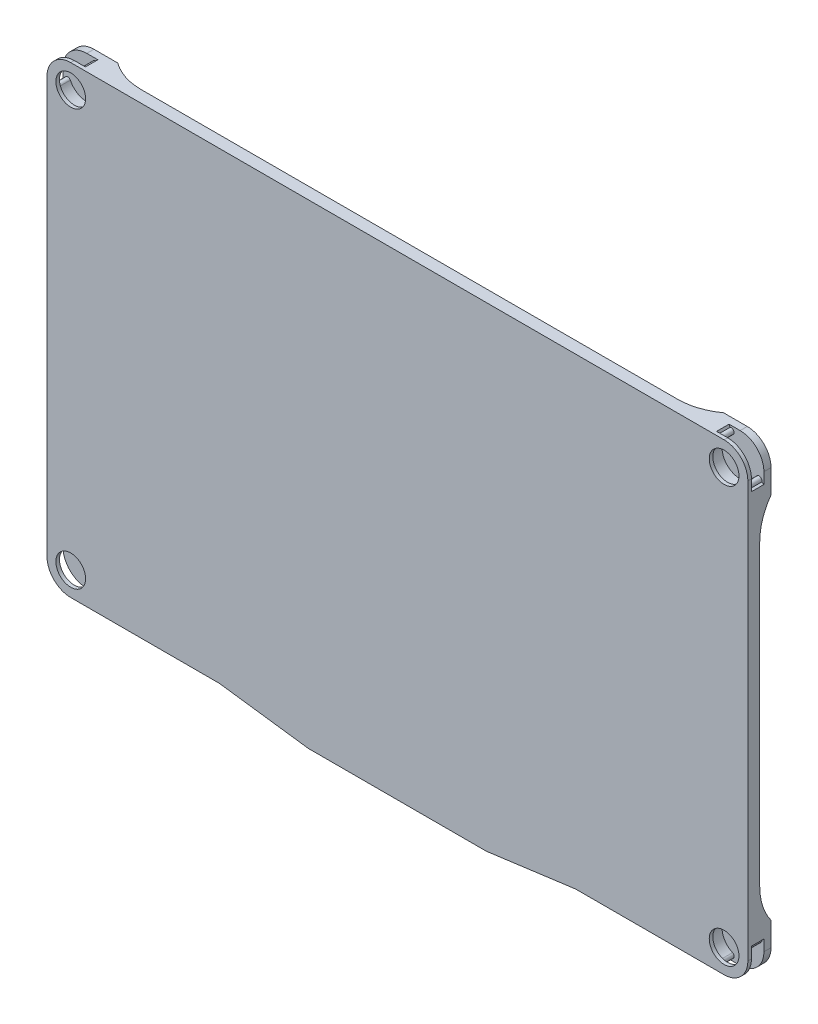
from build123d import *

# Parameters (mm, degrees)
EXTRUDE_1_DEPTH     = 3.9
SKETCH_2_R          = 2.5
CUT_EXTRUDE_1_DEPTH = 0.6
CUT_EXTRUDE_2_DEPTH = 2.1
CUT_EXTRUDE_4_DEPTH = 1.9
FILLET_2_R          = 10


with BuildPart() as part:
    # 草图1 → 凸台-拉伸1 (new body)
    with BuildSketch(Plane.XY):
        with BuildLine():
            Line((-55, -39), (-30, -39))
            Line((-30, -39), (-15, -41))
            Line((-15, -41), (15, -41))
            Line((15, -41), (30, -39))
            Line((30, -39), (55, -39))
            ThreePointArc((55, -39), (57.828427125, -37.828427125), (59, -35))
            Line((59, -35), (59, 35))
            ThreePointArc((59, 35), (57.828427125, 37.828427125), (55, 39))
            Line((55, 39), (-55, 39))
            ThreePointArc((-55, 39), (-57.828427125, 37.828427125), (-59, 35))
            Line((-59, 35), (-59, -35))
            ThreePointArc((-59, -35), (-57.828427125, -37.828427125), (-55, -39))
        make_face()
    extrude(amount=EXTRUDE_1_DEPTH)

    # 草图2 → 切除-拉伸1 (cut)
    with BuildSketch(Plane.XY.offset(3.9)):
        with Locations((55, 35)):
            Circle(SKETCH_2_R)
        with Locations(Location((-55, 35, 0), (0, 0, 180))):
            Circle(SKETCH_2_R)
        with Locations(Location((55, -35, 0), (0, 0, 180))):
            Circle(SKETCH_2_R)
        with Locations((-55, -35)):
            Circle(SKETCH_2_R)
    extrude(amount=-CUT_EXTRUDE_1_DEPTH, mode=Mode.SUBTRACT)

    # 草图3 → 切除-拉伸2 (cut)
    with BuildSketch(Plane.XY.offset(3.3)):
        with BuildLine():
            Line((53.309526953, 38.625231148), (52.886908691, 39.531538935))
            ThreePointArc((52.886908691, 39.531538935), (58.535533906, 38.535533906), (59.531538935, 32.886908691))
            Line((59.531538935, 32.886908691), (58.625231148, 33.309526953))
            ThreePointArc((58.625231148, 33.309526953), (58.395478624, 33.940766826), (57.76423875, 33.711014302))
            ThreePointArc((57.76423875, 33.711014302), (52.843324317, 32.843324317), (53.711014302, 37.76423875))
            ThreePointArc((53.711014302, 37.76423875), (53.940766826, 38.395478624), (53.309526953, 38.625231148))
        make_face()
        with BuildLine():
            Line((-58.625231148, 33.309526953), (-59.531538935, 32.886908691))
            ThreePointArc((-59.531538935, 32.886908691), (-58.535533906, 38.535533906), (-52.886908691, 39.531538935))
            Line((-52.886908691, 39.531538935), (-53.309526953, 38.625231148))
            ThreePointArc((-53.309526953, 38.625231148), (-53.940766826, 38.395478624), (-53.711014302, 37.76423875))
            ThreePointArc((-53.711014302, 37.76423875), (-52.843324317, 32.843324317), (-57.76423875, 33.711014302))
            ThreePointArc((-57.76423875, 33.711014302), (-58.395478624, 33.940766826), (-58.625231148, 33.309526953))
        make_face()
        with BuildLine():
            Line((-53.309526953, -38.625231148), (-52.886908691, -39.531538935))
            ThreePointArc((-52.886908691, -39.531538935), (-58.535533906, -38.535533906), (-59.531538935, -32.886908691))
            Line((-59.531538935, -32.886908691), (-58.625231148, -33.309526953))
            ThreePointArc((-58.625231148, -33.309526953), (-58.395478624, -33.940766826), (-57.76423875, -33.711014302))
            ThreePointArc((-57.76423875, -33.711014302), (-52.843324317, -32.843324317), (-53.711014302, -37.76423875))
            ThreePointArc((-53.711014302, -37.76423875), (-53.940766826, -38.395478624), (-53.309526953, -38.625231148))
        make_face()
        with BuildLine():
            Line((58.625231148, -33.309526953), (59.531538935, -32.886908691))
            ThreePointArc((59.531538935, -32.886908691), (58.535533906, -38.535533906), (52.886908691, -39.531538935))
            Line((52.886908691, -39.531538935), (53.309526953, -38.625231148))
            ThreePointArc((53.309526953, -38.625231148), (53.940766826, -38.395478624), (53.711014302, -37.76423875))
            ThreePointArc((53.711014302, -37.76423875), (52.843324317, -32.843324317), (57.76423875, -33.711014302))
            ThreePointArc((57.76423875, -33.711014302), (58.395478624, -33.940766826), (58.625231148, -33.309526953))
        make_face()
    extrude(amount=-CUT_EXTRUDE_2_DEPTH, mode=Mode.SUBTRACT)

    # 草图5 → 切除-拉伸4 (cut)
    with BuildSketch(Plane(origin=(0, 0, 0), x_dir=(-1, 0, 0), z_dir=(0, 0, -1))):
        with BuildLine():
            Line((-51, 35), (-51, 39))
            Line((-51, 39), (51, 39))
            Line((51, 39), (51, 35))
            ThreePointArc((51, 35), (52.171572875, 32.171572875), (55, 31))
            Line((55, 31), (59, 31))
            Line((59, 31), (59, -31))
            Line((59, -31), (55, -31))
            ThreePointArc((55, -31), (52.171572875, -32.171572875), (51, -35))
            Line((51, -35), (51, -39))
            Line((51, -39), (30, -39))
            Line((30, -39), (15, -41))
            Line((15, -41), (-15, -41))
            Line((-15, -41), (-30, -39))
            Line((-30, -39), (-51, -39))
            Line((-51, -39), (-51, -35))
            ThreePointArc((-51, -35), (-52.171572875, -32.171572875), (-55, -31))
            Line((-55, -31), (-59, -31))
            Line((-59, -31), (-59, 31))
            Line((-59, 31), (-55, 31))
            ThreePointArc((-55, 31), (-52.171572875, 32.171572875), (-51, 35))
        make_face()
    extrude(amount=-CUT_EXTRUDE_4_DEPTH, mode=Mode.SUBTRACT)

    # 圆角2
    # the kernel refuses this fillet: 10 mm, written as the material it adds along each edge
    with BuildSketch(Plane(origin=(-59, -31, 1.9), x_dir=(0, 1, 0), z_dir=(1, 0, 0)), Plane(origin=(-51, 39, 1.9), x_dir=(1, 0, 0), z_dir=(0, -1, 0)), Plane(origin=(55, -31, 1.9), x_dir=(0, 1, 0), z_dir=(1, 0, 0)), Plane(origin=(51, 35, 1.9), x_dir=(-1, 0, 0), z_dir=(0, 1, 0)), Plane(origin=(59, 31, 1.9), x_dir=(0, -1, 0), z_dir=(-1, 0, 0)), Plane(origin=(-55, 31, 1.9), x_dir=(0, -1, 0), z_dir=(-1, 0, 0)), Plane(origin=(51, -39, 1.9), x_dir=(-1, 0, 0), z_dir=(0, 1, 0))) as fillet_2_piece_1:
        with BuildLine():
            CenterArc((5.864298765, -10), FILLET_2_R, 90, 35.904068583)
            Line((0, -1.9), (-0.117285975, -1.738))
            ThreePointArc((-0.117285975, -1.738), (-0.2, -0.95), (-0.2, 0))
            Line((-0.2, 0), (0, 0.2))
            Line((0, 0.2), (5.864298765, 0.2))
            Line((5.864298765, 0.2), (5.864298765, 0))
        make_face()
    extrude(amount=4)
    with BuildSketch(Plane(origin=(-55, -35, 1.9), x_dir=(0, 1, 0), z_dir=(-1, 0, 0))) as fillet_2_piece_2:
        with BuildLine():
            CenterArc((9.864298765, 10), FILLET_2_R, 234.095931417, 35.904068583)
            Line((4, 1.9), (3.882714025, 1.738))
            ThreePointArc((3.882714025, 1.738), (3.8, 0.95), (3.8, 0))
            Line((3.8, 0), (4, -0.2))
            Line((4, -0.2), (9.864298765, -0.2))
            Line((9.864298765, -0.2), (9.864298765, 0))
        make_face()
    revolve(axis=Axis((-55, -35, 1.9), (0, 0, -1)), revolution_arc=90)
    with BuildSketch(Plane(origin=(-55, 35, 1.9), x_dir=(1, 0, 0), z_dir=(0, 1, 0))) as fillet_2_piece_3:
        with BuildLine():
            CenterArc((9.864298765, 10), FILLET_2_R, 234.095931417, 35.904068583)
            Line((4, 1.9), (3.882714025, 1.738))
            ThreePointArc((3.882714025, 1.738), (3.8, 0.95), (3.8, 0))
            Line((3.8, 0), (4, -0.2))
            Line((4, -0.2), (9.864298765, -0.2))
            Line((9.864298765, -0.2), (9.864298765, 0))
        make_face()
    revolve(axis=Axis((-55, 35, 1.9), (0, 0, -1)), revolution_arc=90)
    with BuildSketch(Plane(origin=(55, -35, 1.9), x_dir=(-1, 0, 0), z_dir=(0, -1, 0))) as fillet_2_piece_4:
        with BuildLine():
            CenterArc((9.864298765, 10), FILLET_2_R, 234.095931417, 35.904068583)
            Line((4, 1.9), (3.882714025, 1.738))
            ThreePointArc((3.882714025, 1.738), (3.8, 0.95), (3.8, 0))
            Line((3.8, 0), (4, -0.2))
            Line((4, -0.2), (9.864298765, -0.2))
            Line((9.864298765, -0.2), (9.864298765, 0))
        make_face()
    revolve(axis=Axis((55, -35, 1.9), (0, 0, -1)), revolution_arc=90)
    with BuildSketch(Plane(origin=(-51, -35, 1.9), x_dir=(0, 0, -1), z_dir=(0, -1, 0))) as fillet_2_piece_5:
        with BuildLine():
            CenterArc((10, 5.864298765), FILLET_2_R, 180, 35.904068583)
            Line((0, 5.864298765), (-0.2, 5.864298765))
            Line((-0.2, 5.864298765), (-0.2, 0))
            Line((-0.2, 0), (0, -0.2))
            ThreePointArc((0, -0.2), (0.95, -0.2), (1.738, -0.117285975))
            Line((1.738, -0.117285975), (1.9, 0))
        make_face()
    extrude(amount=4)
    with BuildSketch(Plane(origin=(55, 35, 1.9), x_dir=(0, -1, 0), z_dir=(1, 0, 0))) as fillet_2_piece_6:
        with BuildLine():
            CenterArc((9.864298765, 10), FILLET_2_R, 234.095931417, 35.904068583)
            Line((4, 1.9), (3.882714025, 1.738))
            ThreePointArc((3.882714025, 1.738), (3.8, 0.95), (3.8, 0))
            Line((3.8, 0), (4, -0.2))
            Line((4, -0.2), (9.864298765, -0.2))
            Line((9.864298765, -0.2), (9.864298765, 0))
        make_face()
    revolve(axis=Axis((55, 35, 1.9), (0, 0, -1)), revolution_arc=90)


solid = part.part
